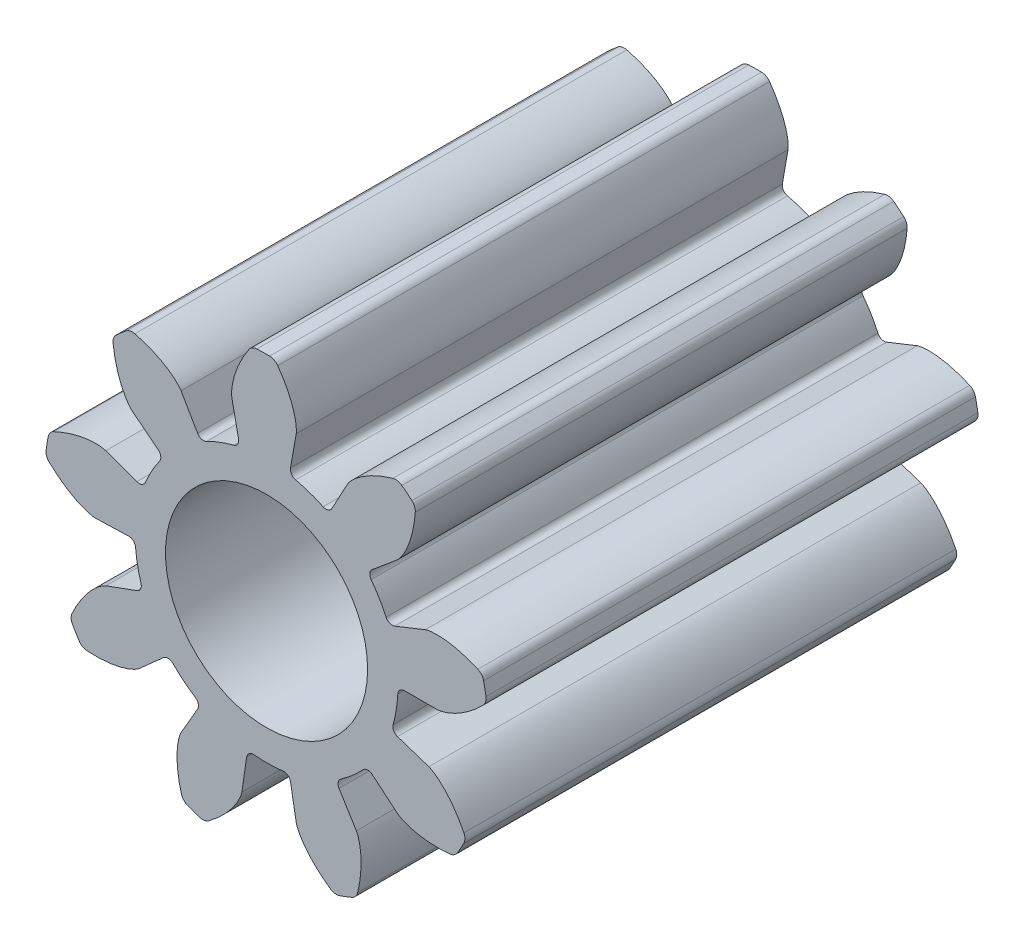
from build123d import *

# Parameters (mm, degrees)
SKETCH1_R                = 1.65
BOSS_EXTRUDE1_DEPTH      = 3.65
CUT_EXTRUDE3_START       = -3.65
CUT_EXTRUDE3_DEPTH       = 3.65
FILLET1_R                = 0.05
FILLET2_R                = 0.075
CIRPATTERN3_COUNT        = 9
FILLET1_OF_CIRPATTERN3_R = 0.05
FILLET2_OF_CIRPATTERN3_R = 0.075
SKETCH5_R                = 0.75
CUT_EXTRUDE4_DEPTH       = 7.212


# Read off the part's stored shape, not the designer's step: Cut-Extrude3
with BuildPart() as part:
    # Sketch1 → Boss-Extrude1 (new body)
    with BuildSketch(Plane.XY):
        Circle(SKETCH1_R)
    extrude(amount=-BOSS_EXTRUDE1_DEPTH)

    # Cut-Extrude3 outline → Cut-Extrude3 (cut)
    with BuildSketch(Plane.XY.offset(CUT_EXTRUDE3_START)):
        with BuildLine():
            add(Edge.make_bspline(
                [(1.480540337, -0.728354522), (1.477101767, -0.720620228), (1.469573903, -0.704152778), (1.457640153, -0.679875773), (1.440092834, -0.646825596), (1.42080558, -0.61413136), (1.400017708, -0.58190439), (1.378249206, -0.551484113), (1.357948774, -0.525733496), (1.339695767, -0.504609389), (1.323906062, -0.487627265), (1.310473998, -0.474065365), (1.296596243, -0.460936718), (1.282260826, -0.448323387), (1.267455019, -0.436284459), (1.253413584, -0.42586002), (1.240261137, -0.416978061), (1.228782765, -0.409988774), (1.219692037, -0.40497871), (1.212387222, -0.401405587), (1.207825106, -0.399409052), (1.205366229, -0.398472916), (1.204481981, -0.398159712)],
                knots=[0.280307251, 0.280307251, 0.280307251, 0.280307251, 0.280307251, 0.328394301, 0.383126635, 0.43785898, 0.492591256, 0.547323565, 0.602055884, 0.652783571, 0.680149903, 0.707515961, 0.734882063, 0.762248421, 0.789614741, 0.816980391, 0.844236067, 0.862480777, 0.880559096, 0.894007228, 0.903714168, 0.909090916, 0.909090916, 0.909090916, 0.909090916, 0.909090916], degree=4))
            ThreePointArc((1.480540337, -0.728354522), (1.629022552, -0.262269945), (1.634329212, 0.226865661))
            add(Edge.make_bspline(
                [(1.268585038, 0), (1.269522907, 1.9847e-05), (1.27215135, 0.000136932), (1.277109572, 0.000600709), (1.285166731, 0.001700579), (1.29537056, 0.003604251), (1.308462583, 0.006637745), (1.323738125, 0.010942845), (1.340341858, 0.016433462), (1.358178064, 0.023217081), (1.375747931, 0.030693713), (1.393045002, 0.038803264), (1.410054883, 0.047464061), (1.430376747, 0.058632283), (1.454337448, 0.072960052), (1.481694198, 0.091037942), (1.511910458, 0.113088757), (1.541762693, 0.137162753), (1.570336795, 0.16215139), (1.597370598, 0.18802408), (1.616320933, 0.207328798), (1.628636901, 0.220601424), (1.634329212, 0.226865661)],
                knots=[0, 0, 0, 0, 0, 0.005376748, 0.015083688, 0.02853182, 0.046610139, 0.064854849, 0.092110525, 0.119476175, 0.146842495, 0.174208853, 0.201574955, 0.228941013, 0.256307345, 0.307035032, 0.361767351, 0.41649966, 0.471231936, 0.525964281, 0.580696615, 0.628783665, 0.628783665, 0.628783665, 0.628783665, 0.628783665], degree=4))
            Line((1.268585038, 0), (0.975, 0))
            ThreePointArc((0.975, 0), (0.962604236, -0.154977695), (0.925732132, -0.306014739))
            Line((0.925732132, -0.306014739), (1.204481981, -0.398159712))
        make_face()
    cut_extrude3 = extrude(amount=CUT_EXTRUDE3_DEPTH, mode=Mode.SUBTRACT)

    # Fillet1
    fillet1_edges = [part.edges().sort_by_distance(p)[0] for p in [
        (0.925732132, -0.306014739, -1.825),
        (0.975, 0, -1.825),
    ]]
    fillet(fillet1_edges, radius=FILLET1_R)

    # Fillet2
    fillet2_edges = [part.edges().sort_by_distance(p)[0] for p in [
        (1.480540337, -0.728354522, -1.825),
        (1.634329212, 0.226865661, -1.825),
    ]]
    fillet(fillet2_edges, radius=FILLET2_R)

    # CirPattern3: Cut-Extrude3 ×9 about axis
    cirpattern3_axis = Axis((0, 0, -3.65), (0, 0, 1))
    for i in range(1, CIRPATTERN3_COUNT):
        add(cut_extrude3.rotate(cirpattern3_axis, i * 360 / CIRPATTERN3_COUNT), mode=Mode.SUBTRACT)

    # Fillet1 of CirPattern3
    fillet1_of_cirpattern3_edges = [part.edges().sort_by_distance(p)[0] for p in [
        (0.905854438, 0.360628254, -1.825),
        (0.746893332, 0.626717919, -1.825),
        (0.462117385, 0.858529279, -1.825),
        (0.169306973, 0.960187559, -1.825),
        (-0.197849528, 0.954714913, -1.825),
        (-0.4875, 0.844374769, -1.825),
        (-0.765240448, 0.604178829, -1.825),
        (-0.916200305, 0.33346964, -1.825),
        (-0.974566858, -0.029059244, -1.825),
        (-0.916200305, -0.33346964, -1.825),
        (-0.727882604, -0.648700174, -1.825),
        (-0.4875, -0.844374769, -1.825),
        (-0.14061399, -0.964807083, -1.825),
        (0.169306973, -0.960187559, -1.825),
        (0.512449473, -0.829470035, -1.825),
        (0.746893332, -0.626717919, -1.825),
    ]]
    fillet(fillet1_of_cirpattern3_edges, radius=FILLET1_OF_CIRPATTERN3_R)

    # Fillet2 of CirPattern3
    fillet2_of_cirpattern3_edges = [part.edges().sort_by_distance(p)[0] for p in [
        (1.60233696, 0.39372105, -1.825),
        (1.106142375, 1.224315747, -1.825),
        (0.974382312, 1.331570167, -1.825),
        (0.060379228, 1.648894888, -1.825),
        (-0.109496649, 1.646362804, -1.825),
        (-1.013636032, 1.301937785, -1.825),
        (-1.142140911, 1.190803988, -1.825),
        (-1.613359726, 0.345789524, -1.825),
        (-1.640364747, 0.178054751, -1.825),
        (-1.458174475, -0.772157499, -1.825),
        (-1.371043688, -0.918008282, -1.825),
        (-0.62069318, -1.528803446, -1.825),
        (-0.460196049, -1.584525038, -1.825),
        (0.507217351, -1.57010527, -1.825),
        (0.665982436, -1.509624918, -1.825),
        (1.397795247, -0.876737389, -1.825),
    ]]
    fillet(fillet2_of_cirpattern3_edges, radius=FILLET2_OF_CIRPATTERN3_R)

    # Sketch5 → Cut-Extrude4 (cut)
    with BuildSketch(Plane.XY):
        Circle(SKETCH5_R)
    extrude(amount=-CUT_EXTRUDE4_DEPTH, mode=Mode.SUBTRACT)


solid = part.part
